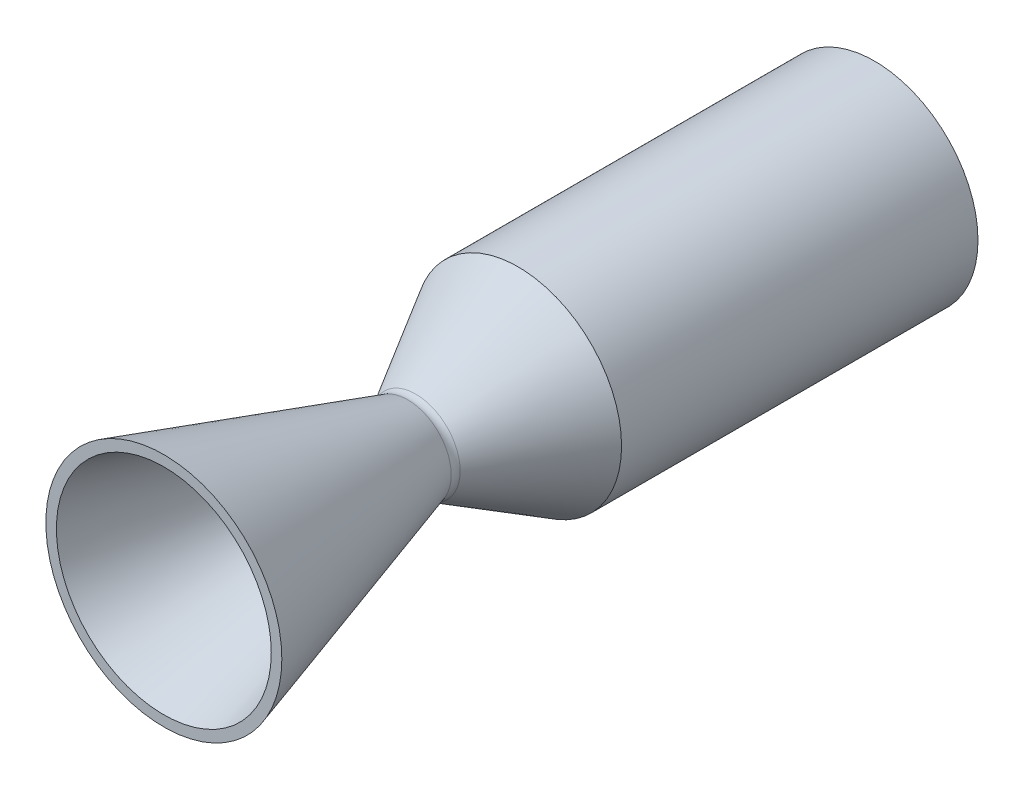
from build123d import *


# Read off the part's stored shape, not the designer's step: Revolve4
with BuildPart() as part:
    # Sketch2 → Revolve1 (revolve)
    with BuildSketch(Plane(origin=(0, 0, 0), x_dir=(1, 0, 0), z_dir=(0, 1, 0)), mode=Mode.PRIVATE) as revolve1_sk:
        with BuildLine():
            Line((0, 88.9), (-23.467681094, 88.9))
            Line((-23.467681094, 88.9), (-23.467681094, 0))
            Line((-23.467681094, 0), (-8.405449734, -26.088549992))
            ThreePointArc((-8.405449734, -26.088549992), (-8.081511216, -27.07075529), (-8.175988072, -28.10067642))
            Line((-8.175988072, -28.10067642), (-27.000254561, -89.717228424))
            Line((-27.000254561, -89.717228424), (0, -89.717228424))
            Line((0, -89.717228424), (0, 88.9))
        make_face()
    revolve(revolve1_sk.sketch.rotate(Axis((0, 0, 0), (0, 0, -1)), 180), axis=Axis((0, 0, 0), (0, 0, -1)))

    # Revolve4 outline → Revolve4 (revolve)
    with BuildSketch(Plane.XZ):
        with BuildLine():
            Line((23.467681094, -88.9), (26.007681094, -88.9))
            Line((26.007681094, -88.9), (26.007681094, 0.680590949))
            Line((26.007681094, 0.680590949), (11.157211277, 26.402359187))
            ThreePointArc((11.157211277, 26.402359187), (10.83327276, 27.384564486), (10.927749616, 28.414485616))
            Line((10.927749616, 28.414485616), (29.656145308, 89.717228424))
            Line((29.656145308, 89.717228424), (27.000254561, 89.717228424))
            Line((27.000254561, 89.717228424), (8.175988072, 28.10067642))
            ThreePointArc((8.175988072, 28.10067642), (8.081511216, 27.07075529), (8.405449734, 26.088549992))
            Line((8.405449734, 26.088549992), (23.467681094, 0))
            Line((23.467681094, 0), (23.467681094, -88.9))
        make_face()
    revolve(axis=Axis((0, 0, 0), (0, 0, 1)))

    # Sketch6 → Cut-Revolve2 (revolve, cut)
    with BuildSketch(Plane(origin=(0, 0, 0), x_dir=(1, 0, 0), z_dir=(0, 1, 0)), mode=Mode.PRIVATE) as cut_revolve2_sk:
        with BuildLine():
            Line((0, 88.9), (-23.467681094, 88.9))
            Line((-23.467681094, 88.9), (-23.467681094, 0))
            Line((-23.467681094, 0), (-8.405449734, -26.088549992))
            ThreePointArc((-8.405449734, -26.088549992), (-8.081511216, -27.07075529), (-8.175988072, -28.10067642))
            Line((-8.175988072, -28.10067642), (-27.000254561, -89.717228424))
            Line((-27.000254561, -89.717228424), (0, -89.717228424))
            Line((0, -89.717228424), (0, 88.9))
        make_face()
    revolve(cut_revolve2_sk.sketch.rotate(Axis((0, 0, 98.648089845), (0, 0, -1)), 180), axis=Axis((0, 0, 98.648089845), (0, 0, -1)), mode=Mode.SUBTRACT)


solid = part.part
